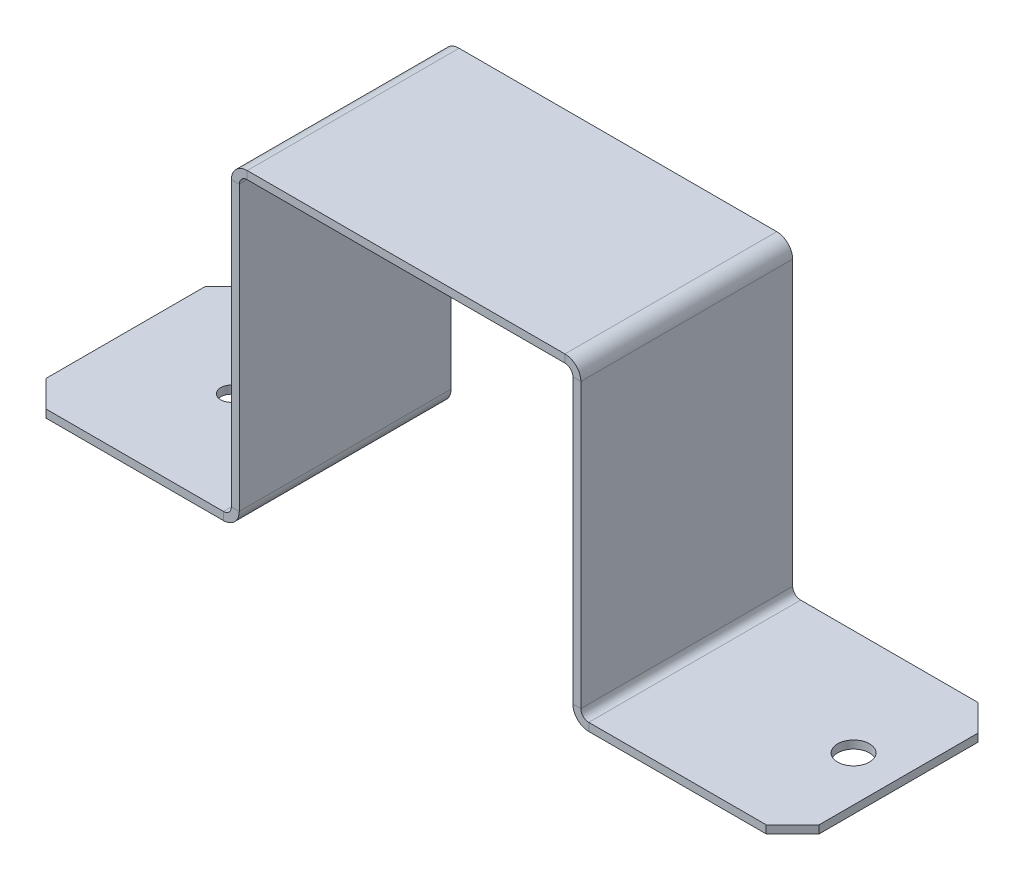
from build123d import *

# Parameters (mm, degrees)
SKETCH1_W          = 60
SKETCH1_H          = 40
BASE_FLANGE1_DEPTH = 1.5
EDGE_FLANGE1_DEPTH = 40
EDGE_FLANGE2_DEPTH = 40
CHAMFER1_SIZE      = 5
CUT_EXTRUDE1_REACH = 97.357
SKETCH10_R         = 2
SKETCH10_R_2       = 3


# Sheet-metal steps are written as plain solids
with BuildPart() as part:
    # Sketch1 → Base-Flange1 (new body)
    with BuildSketch(Plane(origin=(0, 0, 0), x_dir=(1, 0, 0), z_dir=(0, 1, 0))):
        Rectangle(SKETCH1_W, SKETCH1_H)
    extrude(amount=-BASE_FLANGE1_DEPTH)

    # Edge-Flange1 section (across the edge) → Edge-Flange1 (add)
    with BuildSketch(Plane(origin=(-31.5, -1.5, 20), x_dir=(1, 0, 0), z_dir=(0, 0, -1))):
        with BuildLine():
            Line((-1.5, 1.5), (-1.5, 55))
            Line((-1.5, 55), (0, 55))
            Line((0, 55), (0, 1.5))
            ThreePointArc((0, 1.5), (0.439339828, 0.439339828), (1.5, 0))
            Line((1.5, 0), (1.5, -1.5))
            ThreePointArc((1.5, -1.5), (-0.621320344, -0.621320344), (-1.5, 1.5))
        make_face()
    edge_flange1 = extrude(amount=EDGE_FLANGE1_DEPTH)

    # Edge-Flange2 section (across the edge) → Edge-Flange2 (add)
    with BuildSketch(Plane(origin=(-33, -58, -20), x_dir=(0, 1, 0), z_dir=(0, 0, 1))):
        with BuildLine():
            Line((-1.5, 1.5), (-1.5, 40))
            Line((-1.5, 40), (0, 40))
            Line((0, 40), (0, 1.5))
            ThreePointArc((0, 1.5), (0.439339828, 0.439339828), (1.5, 0))
            Line((1.5, 0), (1.5, -1.5))
            ThreePointArc((1.5, -1.5), (-0.621320344, -0.621320344), (-1.5, 1.5))
        make_face()
    edge_flange2 = extrude(amount=EDGE_FLANGE2_DEPTH)

    # Mirror1: Edge-Flange1, Edge-Flange2 across plane
    add(edge_flange1.mirror(Plane(origin=(0, 0, 0), x_dir=(0, 0, 1), z_dir=(1, 0, 0))))
    add(edge_flange2.mirror(Plane(origin=(0, 0, 0), x_dir=(0, 0, 1), z_dir=(1, 0, 0))))

    # Chamfer1
    chamfer1_edges = [part.edges().sort_by_distance(p)[0] for p in [
        (-73, -58.75, -20),
        (-73, -58.75, 20),
        (73, -58.75, 20),
        (73, -58.75, -20),
    ]]
    chamfer(chamfer1_edges, length=CHAMFER1_SIZE)

    # Sketch10 → Cut-Extrude1 (cut, up to next)
    with BuildSketch(Plane(origin=(0, -58, 0), x_dir=(1, 0, 0), z_dir=(0, 1, 0)), mode=Mode.PRIVATE) as cut_extrude1_sk1:
        with Locations(Location((-53, 0, 0), (0, 0, 270))):
            Circle(SKETCH10_R)
    cut_extrude1_tool1 = extrude(cut_extrude1_sk1.sketch, amount=-CUT_EXTRUDE1_REACH, mode=Mode.PRIVATE) & part.part
    # Sketch10 → Cut-Extrude1 (cut, up to next)
    with BuildSketch(Plane(origin=(0, -58, 0), x_dir=(1, 0, 0), z_dir=(0, 1, 0)), mode=Mode.PRIVATE) as cut_extrude1_sk2:
        with Locations(Location((64.5, 0, 0), (0, 0, 270))):
            Circle(SKETCH10_R_2)
    cut_extrude1_tool2 = extrude(cut_extrude1_sk2.sketch, amount=-CUT_EXTRUDE1_REACH, mode=Mode.PRIVATE) & part.part
    add(cut_extrude1_tool1.solids().sort_by_distance((-53, -58, 0))[0], mode=Mode.SUBTRACT)
    add(cut_extrude1_tool2.solids().sort_by_distance((64.5, -58, 0))[0], mode=Mode.SUBTRACT)


solid = part.part
